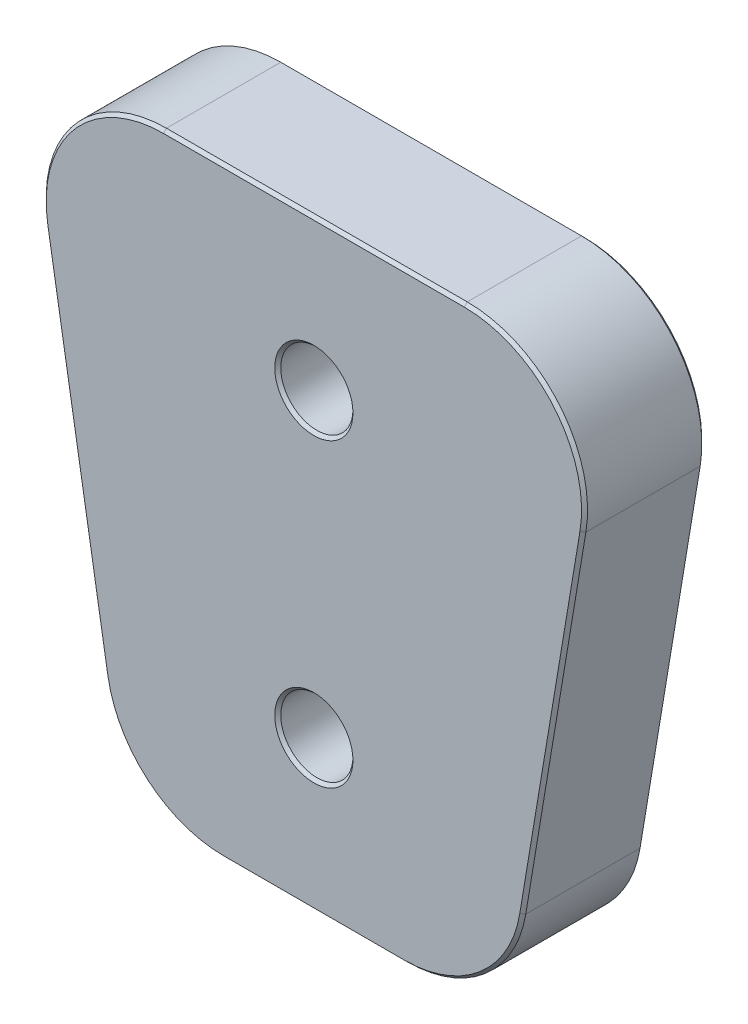
from build123d import *

# Parameters (mm, degrees)
BOSS_EXTRUDE1_DEPTH = 20
SKETCH4_R           = 6
CUT_EXTRUDE1_DEPTH  = 12
SKETCH5_R           = 3.2
CUT_EXTRUDE2_DEPTH  = 131.747809108
CHAMFER1_SIZE       = 0.5


with BuildPart() as part:
    # Sketch3 → Boss-Extrude1 (new body)
    with BuildSketch(Plane.XY):
        with BuildLine():
            Line((-6.355283539, -23.287979746), (3.644716461, -83.287979746))
            ThreePointArc((3.644716461, -83.287979746), (10.445097015, -95.260399649), (23.372594937, -100))
            Line((23.372594937, -100), (53.372594937, -100))
            ThreePointArc((53.372594937, -100), (66.30009286, -95.260399649), (73.100473414, -83.287979746))
            Line((73.100473414, -83.287979746), (83.100473414, -23.287979746))
            ThreePointArc((83.100473414, -23.287979746), (78.632994587, -7.072502077), (63.372594937, 0))
            Line((63.372594937, 0), (13.372594937, 0))
            ThreePointArc((13.372594937, 0), (-1.887804712, -7.072502077), (-6.355283539, -23.287979746))
        make_face()
    extrude(amount=BOSS_EXTRUDE1_DEPTH)

    # Sketch4 → Cut-Extrude1 (cut)
    with BuildSketch(Plane.XY.offset(20)):
        with Locations((38.372594937, -25)):
            Circle(SKETCH4_R)
        with Locations((38.372594937, -75)):
            Circle(SKETCH4_R)
    extrude(amount=-CUT_EXTRUDE1_DEPTH, mode=Mode.SUBTRACT)

    # Sketch5 → Cut-Extrude2 (cut, through all)
    with BuildSketch(Plane.XY.offset(8)):
        with Locations((38.372594937, -25)):
            Circle(SKETCH5_R)
        with Locations((38.372594937, -75)):
            Circle(SKETCH5_R)
    extrude(amount=-CUT_EXTRUDE2_DEPTH, mode=Mode.SUBTRACT)

    # Chamfer1
    chamfer1_edges = [part.edges().sort_by_distance(p)[0] for p in [
        (10.445097015, -95.260399649, 0),
        (38.372594937, -100, 0),
        (66.30009286, -95.260399649, 0),
        (78.100473414, -53.287979746, 0),
        (78.632994587, -7.072502077, 0),
        (38.372594937, 0, 0),
        (-1.887804712, -7.072502077, 0),
        (-1.355283539, -53.287979746, 0),
        (35.172594937, -75, 0),
        (35.172594937, -25, 0),
        (-1.887804712, -7.072502077, 20),
        (38.372594937, 0, 20),
        (78.632994587, -7.072502077, 20),
        (78.100473414, -53.287979746, 20),
        (66.30009286, -95.260399649, 20),
        (38.372594937, -100, 20),
        (10.445097015, -95.260399649, 20),
        (-1.355283539, -53.287979746, 20),
        (32.372594937, -25, 20),
        (32.372594937, -75, 20),
    ]]
    chamfer(chamfer1_edges, length=CHAMFER1_SIZE)


solid = part.part
